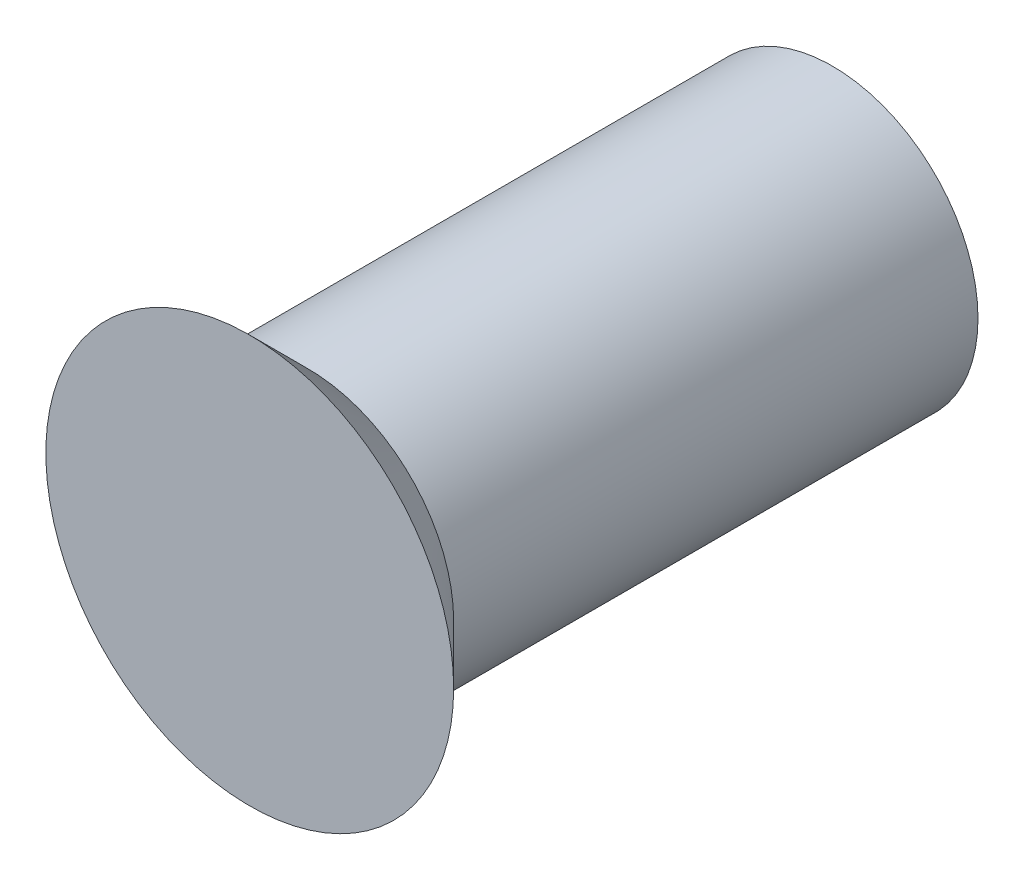
from build123d import *

# Parameters (mm, degrees)
IZIM1_R                     = 2.5
Y_KSEKLIK_EKSTR_ZYON1_DEPTH = 9
IZIM2_R                     = 2.5
Y_KSEKLIK_EKSTR_ZYON2_DEPTH = 1
Y_KSEKLIK_EKSTR_ZYON2_DRAFT = -45


with BuildPart() as part:
    # Çizim1 → Yükseklik-Ekstrüzyon1 (new body)
    with BuildSketch(Plane.XY):
        Circle(IZIM1_R)
    extrude(amount=Y_KSEKLIK_EKSTR_ZYON1_DEPTH)


with BuildPart() as y_kseklik_ekstr_zyon2_tool:
    # Çizim2 → Yükseklik-Ekstrüzyon2 (with draft: the straight prism first)
    with BuildSketch(Plane.XY.offset(9)):
        Circle(IZIM2_R)
    extrude(amount=Y_KSEKLIK_EKSTR_ZYON2_DEPTH)
    # Yükseklik-Ekstrüzyon2: the draft: its side faces are tilted about the plane it starts from
    y_kseklik_ekstr_zyon2_sides = [y_kseklik_ekstr_zyon2_tool.faces().sort_by_distance(p)[0] for p in [
        (-2.5, 0, 9.5),
    ]]
    draft(y_kseklik_ekstr_zyon2_sides, Plane.XY.offset(9), Y_KSEKLIK_EKSTR_ZYON2_DRAFT)


with BuildPart() as part_1:
    add(part.part)

    # Yükseklik-Ekstrüzyon2: add y_kseklik_ekstr_zyon2_tool
    add(y_kseklik_ekstr_zyon2_tool.part)


solid = part_1.part
